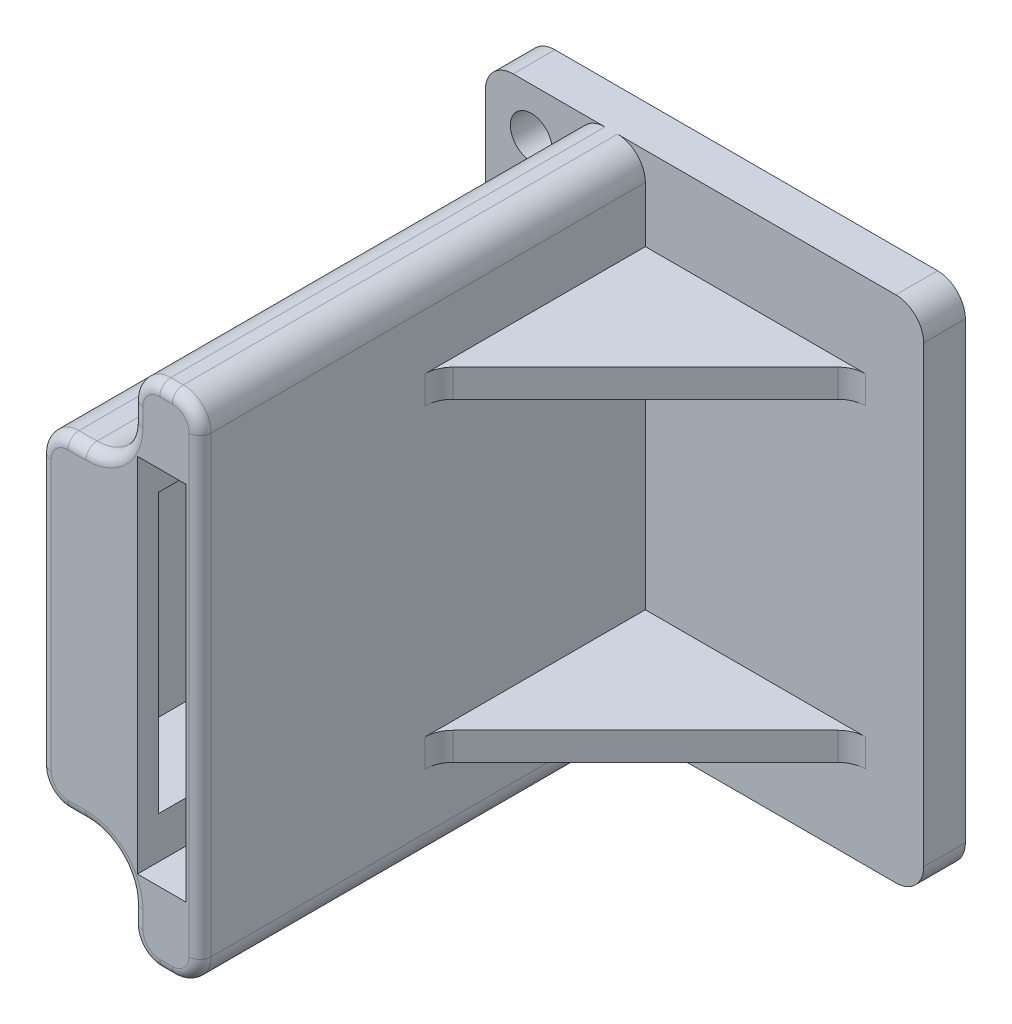
from build123d import *

# Parameters (mm, degrees)
SKETCH1_W           = 14.605
SKETCH1_H           = 46.482
SKETCH1_R           = 1.905
BOSS_EXTRUDE1_DEPTH = 44.45
SKETCH2_W           = 4.445
SKETCH2_H           = 33.02
CUT_EXTRUDE1_DEPTH  = 38.1
SKETCH3_W           = 42.545
SKETCH3_H           = 25.4
CUT_EXTRUDE2_DEPTH  = 12.065
CUT_EXTRUDE3_DEPTH  = 40.64
SKETCH5_W           = 25.4
SKETCH5_H           = 46.482
BOSS_EXTRUDE2_DEPTH = 3.81
FILLET1_R           = 2.54
FILLET2_R           = 1.016
CHAMFER1_SIZE       = 7.62
BOSS_EXTRUDE3_START = -7.62
BOSS_EXTRUDE3_DEPTH = 2.54
FILLET4_R           = 2.54


with BuildPart() as part:
    # Sketch1 → Boss-Extrude1 (new body)
    with BuildSketch(Plane.XY):
        with Locations((7.3025, 23.241)):
            Rectangle(SKETCH1_W, SKETCH1_H)
        with Locations((4.191, 42.291)):
            Circle(SKETCH1_R, mode=Mode.SUBTRACT)
        with Locations((4.191, 4.191)):
            Circle(SKETCH1_R, mode=Mode.SUBTRACT)
    extrude(amount=BOSS_EXTRUDE1_DEPTH)

    # Sketch2 → Cut-Extrude1 (cut)
    with BuildSketch(Plane.XY.offset(44.45)):
        with Locations((11.1125, 23.241)):
            Rectangle(SKETCH2_W, SKETCH2_H)
    extrude(amount=-CUT_EXTRUDE1_DEPTH, mode=Mode.SUBTRACT)

    # Sketch3 → Cut-Extrude2 (cut)
    with BuildSketch(Plane.ZY.offset(-13.335)):
        with Locations((21.2725, 23.241)):
            Rectangle(SKETCH3_W, SKETCH3_H)
    extrude(amount=CUT_EXTRUDE2_DEPTH, mode=Mode.SUBTRACT)

    # Sketch4 → Cut-Extrude3 (cut)
    with BuildSketch(Plane.XY.offset(44.45)):
        with BuildLine():
            Line((4.191, 38.1), (0, 38.1))
            Line((0, 38.1), (0, 46.482))
            Line((0, 46.482), (8.382, 46.482))
            Line((8.382, 46.482), (8.382, 42.291))
            ThreePointArc((8.382, 42.291), (7.15448452, 39.32751548), (4.191, 38.1))
        make_face()
        with BuildLine():
            Line((4.191, 8.382), (0, 8.382))
            Line((0, 8.382), (0, 0))
            Line((0, 0), (8.382, 0))
            Line((8.382, 0), (8.382, 4.191))
            ThreePointArc((8.382, 4.191), (7.15448452, 7.15448452), (4.191, 8.382))
        make_face()
    extrude(amount=-CUT_EXTRUDE3_DEPTH, mode=Mode.SUBTRACT)

    # Sketch5 → Boss-Extrude2 (add)
    with BuildSketch(Plane(origin=(0, 0, 0), x_dir=(-1, 0, 0), z_dir=(0, 0, -1))):
        with Locations((-27.305, 23.241)):
            Rectangle(SKETCH5_W, SKETCH5_H)
    extrude(amount=-BOSS_EXTRUDE2_DEPTH)

    # Fillet1
    fillet1_edges = [part.edges().sort_by_distance(p)[0] for p in [
        (8.382, 46.482, 24.13),
        (0, 38.1, 24.13),
        (0, 8.382, 24.13),
        (8.382, 0, 24.13),
        (0, 0, 1.905),
        (14.605, 0, 24.13),
        (14.605, 46.482, 24.13),
        (0, 46.482, 1.905),
        (40.005, 0, 1.905),
        (40.005, 46.482, 1.905),
    ]]
    fillet(fillet1_edges, radius=FILLET1_R)

    # Fillet2
    fillet2_edges = [part.edges().sort_by_distance(p)[0] for p in [
        (11.4935, 0, 44.45),
        (0, 23.241, 44.45),
        (11.4935, 46.482, 44.45),
        (8.382, 3.3655, 44.45),
        (14.605, 23.241, 44.45),
        (3.3655, 38.1, 44.45),
        (13.861051224, 45.738051224, 44.45),
        (13.861051224, 0.743948776, 44.45),
        (9.125948776, 0.743948776, 44.45),
        (0.743948776, 9.125948776, 44.45),
        (0.743948776, 37.356051224, 44.45),
        (9.125948776, 45.738051224, 44.45),
        (7.15448452, 39.32751548, 44.45),
        (8.382, 43.1165, 44.45),
        (7.15448452, 7.15448452, 44.45),
        (3.3655, 8.382, 44.45),
    ]]
    fillet(fillet2_edges, radius=FILLET2_R)

    # Chamfer1
    chamfer1_edges = [part.edges().sort_by_distance(p)[0] for p in [
        (1.27, 23.241, 42.545),
    ]]
    chamfer(chamfer1_edges, length=CHAMFER1_SIZE - 0.0001)  # a hair under: the kernel refuses the full size

    # Sketch6 → Boss-Extrude3 (add)
    with BuildSketch(Plane.XZ.offset(BOSS_EXTRUDE3_START)):
        Polygon((14.605, 22.86), (33.655, 3.81), (14.605, 3.81), align=None)
    boss_extrude3 = extrude(amount=-BOSS_EXTRUDE3_DEPTH)

    # Mirror1: Boss-Extrude3 across plane
    add(boss_extrude3.mirror(Plane(origin=(0, 23.241, 0), x_dir=(0, 0, 1), z_dir=(0, -1, 0))))

    # Fillet4
    fillet4_edges = [part.edges().sort_by_distance(p)[0] for p in [
        (14.605, 8.89, 22.86),
        (33.655, 8.89, 3.81),
        (14.605, 37.592, 22.86),
        (33.655, 37.592, 3.81),
    ]]
    fillet(fillet4_edges, radius=FILLET4_R)


solid = part.part
